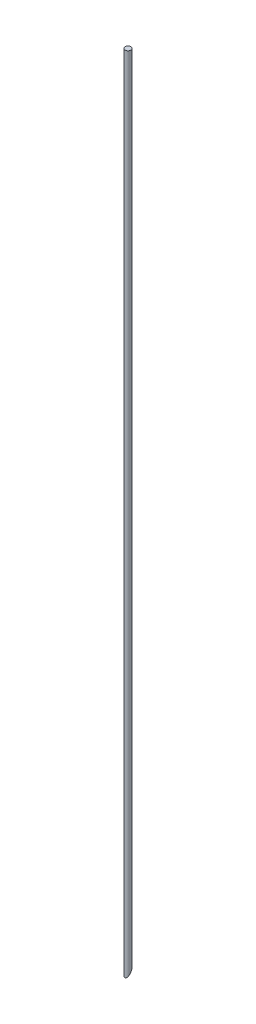
from build123d import *

# Parameters (mm, degrees)
SKETCH1_R               = 0.11
BOSS_EXTRUDE1_DEPTH     = 30
CUT_EXTRUDE1_DEPTH      = 31.000403331
CUT_EXTRUDE1_DEPTH_BACK = 31.000403331


with BuildPart() as part:
    # Sketch1 → Boss-Extrude1 (new body)
    with BuildSketch(Plane(origin=(0, 0, 0), x_dir=(1, 0, 0), z_dir=(0, 1, 0))):
        Circle(SKETCH1_R)
    extrude(amount=-BOSS_EXTRUDE1_DEPTH)

    # Sketch3 → Cut-Extrude1 (cut, two sides: drawn at the far end of the back side and taken through both)
    with BuildSketch(Plane(origin=(0, 0, 0), x_dir=(0, 0, -1), z_dir=(1, 0, 0)).offset(-CUT_EXTRUDE1_DEPTH_BACK)):
        Polygon((-0.11, -30), (0.11, -29.618948822), (0.11, -30), align=None)
    extrude(amount=CUT_EXTRUDE1_DEPTH + CUT_EXTRUDE1_DEPTH_BACK, mode=Mode.SUBTRACT)


solid = part.part
